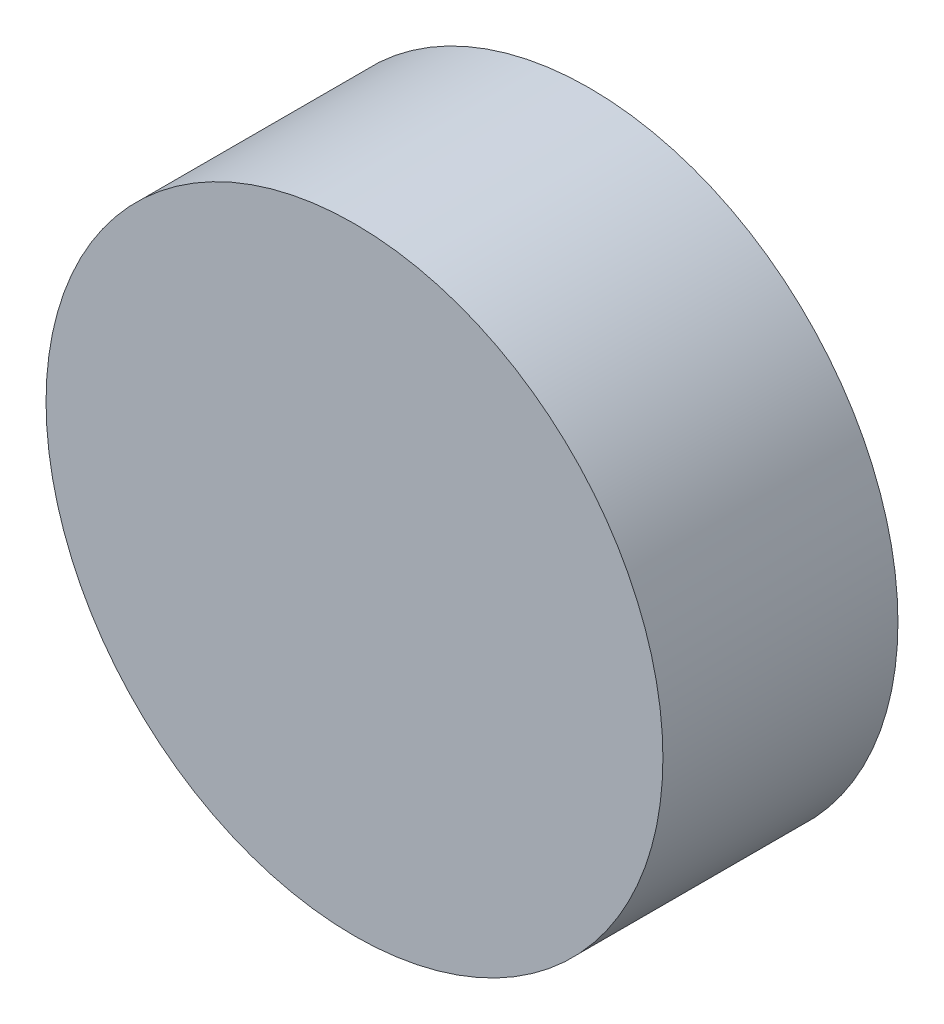
from build123d import *

# Parameters (mm, degrees)
SKETCH1_R           = 25
BOSS_EXTRUDE1_DEPTH = 9.525


with BuildPart() as part:
    # Sketch1 → Boss-Extrude1 (new, symmetric)
    with BuildSketch(Plane.XY):
        Circle(SKETCH1_R)
    extrude(amount=BOSS_EXTRUDE1_DEPTH, both=True)


solid = part.part
